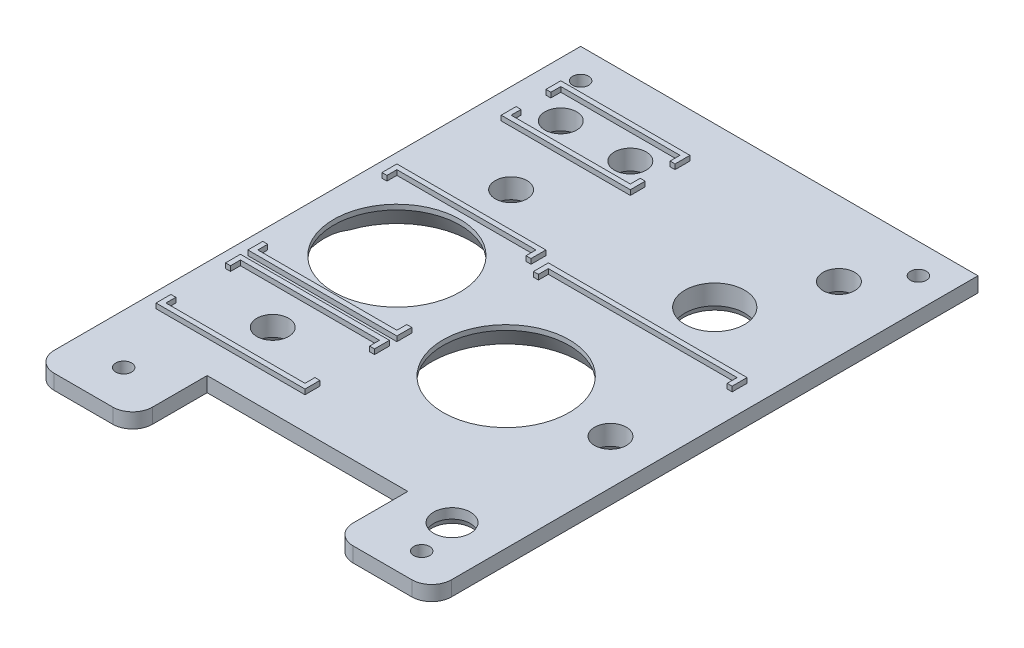
from build123d import *
from OCP.BRepFilletAPI import BRepFilletAPI_MakeChamfer

# Parameters (mm, degrees)
SKETCH1_W           = 80
SKETCH1_H           = 110
BOSS_EXTRUDE1_DEPTH = 3
SKETCH2_W           = 40.4
SKETCH2_H           = 3
CUT_EXTRUDE1_DEPTH  = 15
FILLET1_R           = 4
SKETCH7_W           = 73.6
SKETCH7_H           = 86.6
BOSS_EXTRUDE2_DEPTH = 2
SKETCH3_R           = 12.7
CUT_EXTRUDE2_DEPTH  = 69.190908485
SKETCH4_R           = 6
SKETCH4_R_2         = 3.2
SKETCH4_R_3         = 3.7
SKETCH4_R_4         = 1.6
CUT_EXTRUDE3_DEPTH  = 69.190908485
CHAMFER2_SIZE       = 1.5
CHAMFER2_SIZE2      = 0.545955351
CHAMFER3_SIZE       = 2.309401077
CHAMFER3_SIZE_2     = 4
BOSS_EXTRUDE3_DEPTH = 1
CHAMFER4_SIZE       = 1
CHAMFER4_SIZE2      = 0.363970234


with BuildPart() as part:
    # Sketch1 → Boss-Extrude1 (new body)
    with BuildSketch(Plane(origin=(0, 0, 0), x_dir=(1, 0, 0), z_dir=(0, 1, 0))):
        Rectangle(SKETCH1_W, SKETCH1_H)
    extrude(amount=BOSS_EXTRUDE1_DEPTH)

    # Sketch2 → Cut-Extrude1 (cut)
    with BuildSketch(Plane.XY.offset(55)):
        with Locations((0, 1.5)):
            Rectangle(SKETCH2_W, SKETCH2_H)
    extrude(amount=-CUT_EXTRUDE1_DEPTH, mode=Mode.SUBTRACT)

    # Fillet1
    fillet1_edges = [part.edges().sort_by_distance(p)[0] for p in [
        (-20.2, 1.5, 55),
        (20.2, 1.5, 55),
        (40, 1.5, 55),
        (-40, 1.5, 55),
    ]]
    fillet(fillet1_edges, radius=FILLET1_R)

    # Sketch7 → Boss-Extrude2 (add)
    with BuildSketch(Plane.XZ):
        with Locations((0, -8.5)):
            Rectangle(SKETCH7_W, SKETCH7_H)
    extrude(amount=BOSS_EXTRUDE2_DEPTH)

    # Sketch3 → Cut-Extrude2 (cut, through all)
    with BuildSketch(Plane(origin=(0, 3, 0), x_dir=(1, 0, 0), z_dir=(0, 1, 0))):
        with Locations(Location((-22, 0, 0), (0, 0, 270))):
            Circle(SKETCH3_R)
        with Locations(Location((10, -10, 0), (0, 0, 270))):
            Circle(SKETCH3_R)
    extrude(amount=-CUT_EXTRUDE2_DEPTH, mode=Mode.SUBTRACT)

    # Sketch4 → Cut-Extrude3 (cut, through all)
    with BuildSketch(Plane(origin=(0, 3, 0), x_dir=(1, 0, 0), z_dir=(0, 1, 0))):
        with Locations(Location((19, 23, 0), (0, 0, 270))):
            Circle(SKETCH4_R)
        with Locations(Location((-22, 23, 0), (0, 0, 270))):
            Circle(SKETCH4_R_2)
        with Locations(Location((31, -10, 0), (0, 0, 270))):
            Circle(SKETCH4_R_2)
        with Locations(Location((30.1, -41, 0), (0, 0, 270))):
            Circle(SKETCH4_R_3)
        with Locations(Location((-29, 40, 0), (0, 0, 270))):
            Circle(SKETCH4_R_2)
        with Locations(Location((-15, 40, 0), (0, 0, 270))):
            Circle(SKETCH4_R_2)
        with Locations(Location((27, 40, 0), (0, 0, 270))):
            Circle(SKETCH4_R_2)
        with Locations(Location((-22, -25, 0), (0, 0, 270))):
            Circle(SKETCH4_R_2)
        with Locations(Location((-30, -47, 0), (0, 0, 270))):
            Circle(SKETCH4_R_4)
        with Locations(Location((-34, 49, 0), (0, 0, 270))):
            Circle(SKETCH4_R_4)
        with Locations(Location((34, 49, 0), (0, 0, 270))):
            Circle(SKETCH4_R_4)
        with Locations(Location((32, -49, 0), (0, 0, 270))):
            Circle(SKETCH4_R_4)
    extrude(amount=-CUT_EXTRUDE3_DEPTH, mode=Mode.SUBTRACT)

    # Chamfer2: one chamfer whose edges measure the first distance from different faces: ONE call of the kernel's chamfer builder (chamfer() names one face for all edges)
    chamfer2_edges_1 = [part.edges().sort_by_distance(p)[0] for p in [
        (-36.8, -2, -8.5),
    ]]
    chamfer2_side_1 = [part.faces().sort_by_distance(p)[0] for p in [
        (-36.8, -1, -8.5),
    ]]
    chamfer2_edges_2 = [part.edges().sort_by_distance(p)[0] for p in [
        (0, -2, -51.8),
    ]]
    chamfer2_side_2 = [part.faces().sort_by_distance(p)[0] for p in [
        (0, -1, -51.8),
    ]]
    chamfer2_edges_3 = [part.edges().sort_by_distance(p)[0] for p in [
        (36.8, -2, -8.5),
    ]]
    chamfer2_side_3 = [part.faces().sort_by_distance(p)[0] for p in [
        (36.8, -1, -8.5),
    ]]
    chamfer2_edges_4 = [part.edges().sort_by_distance(p)[0] for p in [
        (0, -2, 34.8),
    ]]
    chamfer2_side_4 = [part.faces().sort_by_distance(p)[0] for p in [
        (0, -1, 34.8),
    ]]
    chamfer2 = BRepFilletAPI_MakeChamfer(part.part.solid().wrapped)
    for e in chamfer2_edges_1:
        chamfer2.Add(CHAMFER2_SIZE, CHAMFER2_SIZE2, e.wrapped, chamfer2_side_1[0].wrapped)  # the first distance lies on this face
    for e in chamfer2_edges_2:
        chamfer2.Add(CHAMFER2_SIZE, CHAMFER2_SIZE2, e.wrapped, chamfer2_side_2[0].wrapped)  # the first distance lies on this face
    for e in chamfer2_edges_3:
        chamfer2.Add(CHAMFER2_SIZE, CHAMFER2_SIZE2, e.wrapped, chamfer2_side_3[0].wrapped)  # the first distance lies on this face
    for e in chamfer2_edges_4:
        chamfer2.Add(CHAMFER2_SIZE, CHAMFER2_SIZE2, e.wrapped, chamfer2_side_4[0].wrapped)  # the first distance lies on this face
    add(Compound.cast(chamfer2.Shape()), mode=Mode.REPLACE)

    # Chamfer3
    # the kernel refuses this chamfer: 4, 2.309401077 mm, written as the material it takes off along each edge
    with BuildSketch(Plane(origin=(-22, -2, 0), x_dir=(0, 0, 1), z_dir=(-1, 0, 0))) as chamfer3_piece_1:
        Polygon((12.7 + CHAMFER3_SIZE, 0), (12.7, CHAMFER3_SIZE_2), (12.7, 0), align=None)
    revolve(axis=Axis((-22, -2, 0), (0, 1, 0)), mode=Mode.SUBTRACT)
    with BuildSketch(Plane(origin=(10, -2, 10), x_dir=(0, 0, 1), z_dir=(-1, 0, 0))) as chamfer3_piece_2:
        Polygon((12.7 + CHAMFER3_SIZE, 0), (12.7, CHAMFER3_SIZE_2), (12.7, 0), align=None)
    revolve(axis=Axis((10, -2, 10), (0, 1, 0)), mode=Mode.SUBTRACT)

    # Sketch8 → Boss-Extrude3 (add)
    with BuildSketch(Plane(origin=(0, 3, 0), x_dir=(1, 0, 0), z_dir=(0, 1, 0))):
        Polygon((-35, 43), (-35, 46), (-9, 46), (-9, 43), (-10, 43), (-10, 45), (-34, 45), (-34, 43), align=None)
        Polygon((-9, 37), (-9, 34), (-35, 34), (-35, 37), (-34, 37), (-34, 35), (-10, 35), (-10, 37), align=None)
        Polygon((-37, 12), (-37, 15), (-7, 15), (-7, 12), (-8, 12), (-8, 14), (-36, 14), (-36, 12), align=None)
        Polygon((-4.5, 10), (-4.5, 13), (35.5, 13), (35.5, 10), (34.5, 10), (34.5, 12), (-3.5, 12), (-3.5, 10), align=None)
        Polygon((-7, -12), (-7, -15), (-37, -15), (-37, -12), (-36, -12), (-36, -14), (-8, -14), (-8, -12), align=None)
        Polygon((-37, -19.5), (-37, -16.5), (-7, -16.5), (-7, -19.5), (-8, -19.5), (-8, -17.5), (-36, -17.5), (-36, -19.5), align=None)
        Polygon((-7, -30.5), (-7, -33.5), (-37, -33.5), (-37, -30.5), (-36, -30.5), (-36, -32.5), (-8, -32.5), (-8, -30.5), align=None)
    extrude(amount=BOSS_EXTRUDE3_DEPTH)

    # Chamfer4: one chamfer whose edges measure the first distance from different faces: ONE call of the kernel's chamfer builder (chamfer() names one face for all edges)
    chamfer4_edges_1 = [part.edges().sort_by_distance(p)[0] for p in [
        (-22, -2, 21.8),
    ]]
    chamfer4_side_1 = [part.faces().sort_by_distance(p)[0] for p in [
        (-22, 0.5, 21.8),
    ]]
    chamfer4_edges_2 = [part.edges().sort_by_distance(p)[0] for p in [
        (-22, -2, -26.2),
    ]]
    chamfer4_side_2 = [part.faces().sort_by_distance(p)[0] for p in [
        (-22, 0.5, -26.2),
    ]]
    chamfer4_edges_3 = [part.edges().sort_by_distance(p)[0] for p in [
        (31, -2, 6.8),
    ]]
    chamfer4_side_3 = [part.faces().sort_by_distance(p)[0] for p in [
        (31, 0.5, 6.8),
    ]]
    chamfer4_edges_4 = [part.edges().sort_by_distance(p)[0] for p in [
        (30.1, 0, 37.3),
    ]]
    chamfer4_side_4 = [part.faces().sort_by_distance(p)[0] for p in [
        (30.1, 1.5, 37.3),
    ]]
    chamfer4_edges_5 = [part.edges().sort_by_distance(p)[0] for p in [
        (-29, -2, -43.2),
    ]]
    chamfer4_side_5 = [part.faces().sort_by_distance(p)[0] for p in [
        (-29, 0.5, -43.2),
    ]]
    chamfer4_edges_6 = [part.edges().sort_by_distance(p)[0] for p in [
        (-15, -2, -43.2),
    ]]
    chamfer4_side_6 = [part.faces().sort_by_distance(p)[0] for p in [
        (-15, 0.5, -43.2),
    ]]
    chamfer4_edges_7 = [part.edges().sort_by_distance(p)[0] for p in [
        (19, -2, -29),
    ]]
    chamfer4_side_7 = [part.faces().sort_by_distance(p)[0] for p in [
        (19, 0.5, -29),
    ]]
    chamfer4_edges_8 = [part.edges().sort_by_distance(p)[0] for p in [
        (27, -2, -43.2),
    ]]
    chamfer4_side_8 = [part.faces().sort_by_distance(p)[0] for p in [
        (27, 0.5, -43.2),
    ]]
    chamfer4 = BRepFilletAPI_MakeChamfer(part.part.solid().wrapped)
    for e in chamfer4_edges_1:
        chamfer4.Add(CHAMFER4_SIZE, CHAMFER4_SIZE2, e.wrapped, chamfer4_side_1[0].wrapped)  # the first distance lies on this face
    for e in chamfer4_edges_2:
        chamfer4.Add(CHAMFER4_SIZE, CHAMFER4_SIZE2, e.wrapped, chamfer4_side_2[0].wrapped)  # the first distance lies on this face
    for e in chamfer4_edges_3:
        chamfer4.Add(CHAMFER4_SIZE, CHAMFER4_SIZE2, e.wrapped, chamfer4_side_3[0].wrapped)  # the first distance lies on this face
    for e in chamfer4_edges_4:
        chamfer4.Add(CHAMFER4_SIZE, CHAMFER4_SIZE2, e.wrapped, chamfer4_side_4[0].wrapped)  # the first distance lies on this face
    for e in chamfer4_edges_5:
        chamfer4.Add(CHAMFER4_SIZE, CHAMFER4_SIZE2, e.wrapped, chamfer4_side_5[0].wrapped)  # the first distance lies on this face
    for e in chamfer4_edges_6:
        chamfer4.Add(CHAMFER4_SIZE, CHAMFER4_SIZE2, e.wrapped, chamfer4_side_6[0].wrapped)  # the first distance lies on this face
    for e in chamfer4_edges_7:
        chamfer4.Add(CHAMFER4_SIZE, CHAMFER4_SIZE2, e.wrapped, chamfer4_side_7[0].wrapped)  # the first distance lies on this face
    for e in chamfer4_edges_8:
        chamfer4.Add(CHAMFER4_SIZE, CHAMFER4_SIZE2, e.wrapped, chamfer4_side_8[0].wrapped)  # the first distance lies on this face
    add(Compound.cast(chamfer4.Shape()), mode=Mode.REPLACE)


solid = part.part
